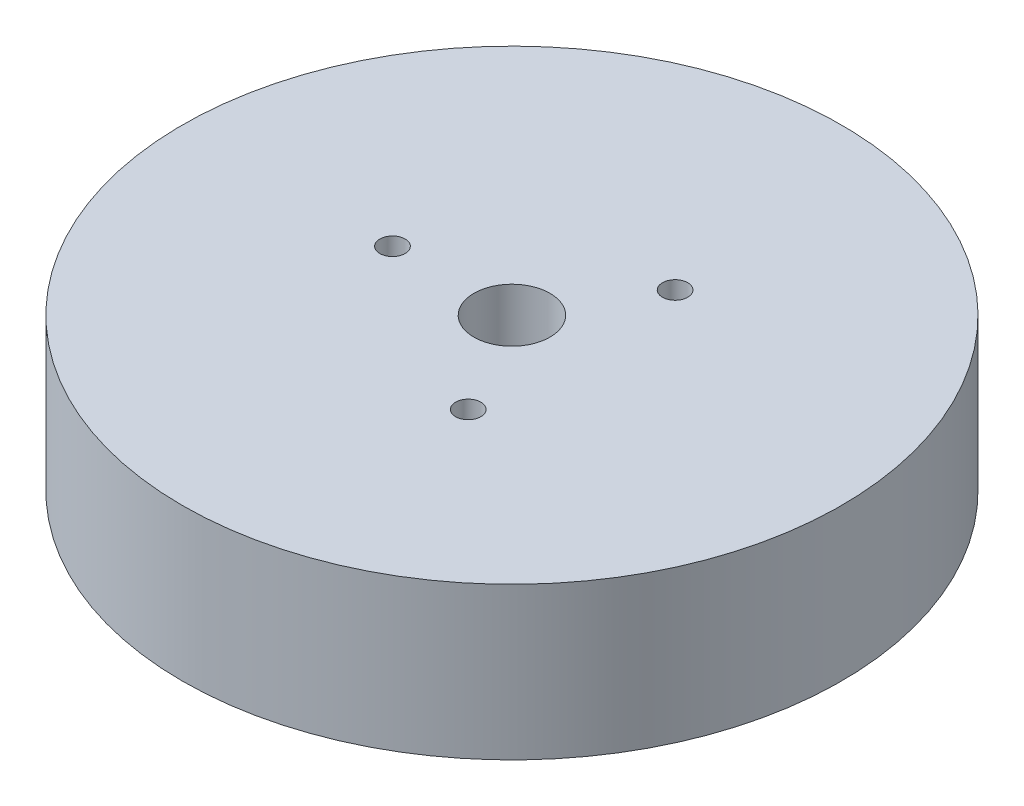
from build123d import *

# Parameters (mm, degrees)
SKETCH1_R           = 65
BOSS_EXTRUDE1_DEPTH = 30
SKETCH2_R           = 7.5
CUT_EXTRUDE1_DEPTH  = 97.695398029
SKETCH3_R           = 2.491328427
CUT_EXTRUDE2_DEPTH  = 27.380658671
CIRPATTERN1_COUNT   = 3


with BuildPart() as part:
    # Sketch1 → Boss-Extrude1 (new body)
    with BuildSketch(Plane(origin=(0, 0, 0), x_dir=(1, 0, 0), z_dir=(0, 1, 0))):
        Circle(SKETCH1_R)
    extrude(amount=BOSS_EXTRUDE1_DEPTH)

    # Sketch2 → Cut-Extrude1 (cut, through all)
    with BuildSketch(Plane(origin=(0, 0, 0), x_dir=(1, 0, 0), z_dir=(0, 1, 0))):
        Circle(SKETCH2_R)
    extrude(amount=CUT_EXTRUDE1_DEPTH, mode=Mode.SUBTRACT)

    # Sketch3 → Cut-Extrude2 (cut)
    with BuildSketch(Plane(origin=(0, 30, 0), x_dir=(1, 0, 0), z_dir=(0, 1, 0))):
        with Locations((-23.556350702, 0)):
            Circle(SKETCH3_R)
    cut_extrude2 = extrude(amount=-CUT_EXTRUDE2_DEPTH, mode=Mode.SUBTRACT)

    # CirPattern1: Cut-Extrude2 ×3 about axis
    cirpattern1_axis = Axis((0, 0, 0), (0, 1, 0))
    for i in range(1, CIRPATTERN1_COUNT):
        add(cut_extrude2.rotate(cirpattern1_axis, i * 360 / CIRPATTERN1_COUNT), mode=Mode.SUBTRACT)


solid = part.part
